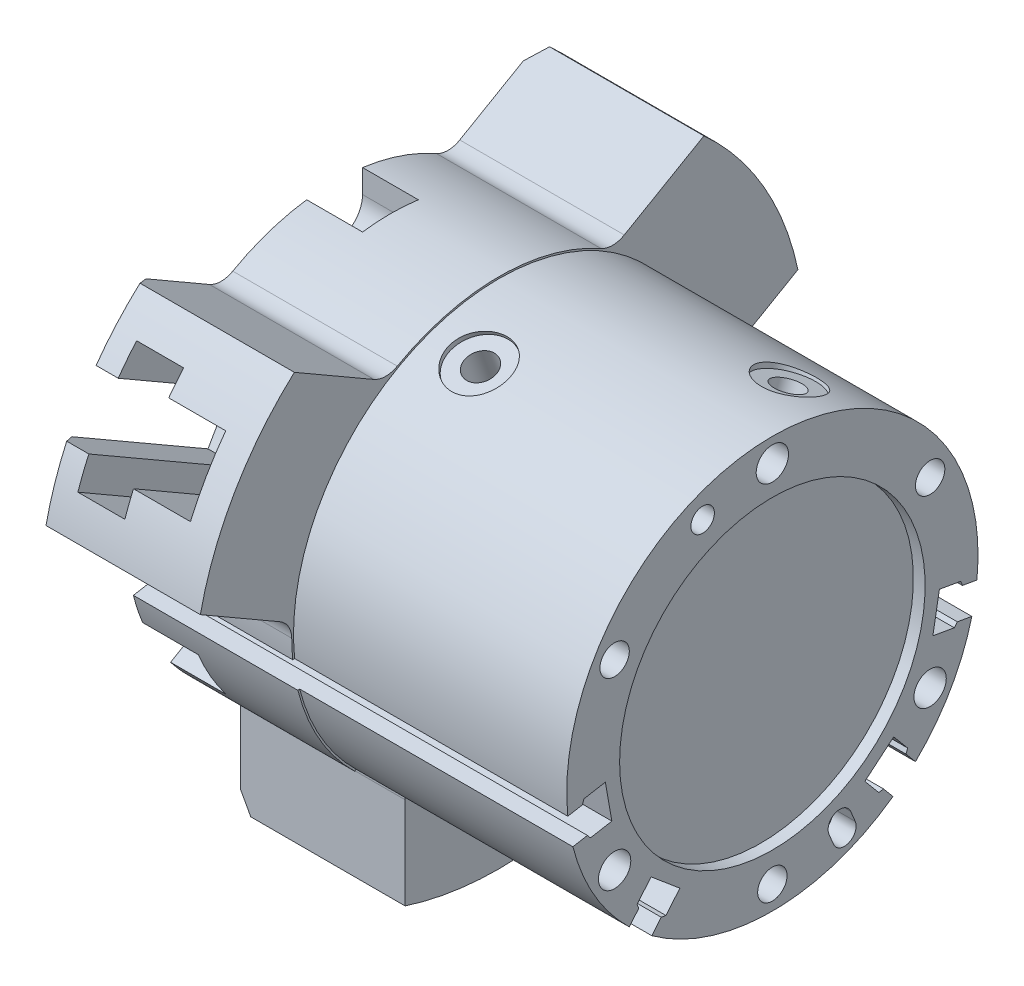
from build123d import *

# Parameters (mm, degrees)
FINGER_CUT1_SKETCH_W   = 13.5
FINGER_CUT1_SKETCH_H   = 30
FINGER_CUT1_DEPTH      = 5
SKETCH1_OUTSIDE_W      = 138.974
SKETCH1_OUTSIDE_H      = 138.974
L_STYLECUT_DEPTH       = 105.681660285
FINGER_CUT2_SKETCH_W   = 8
FINGER_CUT2_SKETCH_H   = 30
FINGER_CUT2_DEPTH      = 10
SKETCH3_W              = 9.7
SKETCH3_H              = 12
L_NOTCH_DEPTH          = 109.662716825
MOUNT_HOLE_SKETCH_R    = 2.75
MOUNT_HOLE_DEPTH       = 105.114490486
MOUNT_GROOVE_START     = -74.5
MOUNT_GROOVE_OUTLINE_R = 2.75
MOUNT_GROOVE_DEPTH     = 9.5
FINGER_MOUNT_SKETCH_R  = 2.5
FINGER_MOUNT_DEPTH     = 10
CIRPATTERN1_COUNT      = 3
REAR_CUT_SKETCH_R      = 2
REAR_CUT_DEPTH         = 4
SWITCH_GROOVE1_DEPTH   = 105.114490486
CIRPATTERN2_COUNT      = 2
CIRPATTERN2_ANGLE      = 40
MIRROR1_COPY_1_DEPTH   = 105.114490486


# Read off the part's stored shape, not the designer's step: Mount_Groove
with BuildPart() as part:
    # Body_Sketch → Body (revolve)
    with BuildSketch(Plane.XY, mode=Mode.PRIVATE) as body_sk:
        Polygon((-2, 0), (-2, 26), (0, 26), (0, 35), (-46.5, 35), (-46.5, 52), (-72.767949192, 52), (-74.5, 49), (-74.5, 0), align=None)
    revolve(body_sk.sketch.rotate(Axis((-65.1, 0, 0), (1, 0, 0)), 90), axis=Axis((-65.1, 0, 0), (1, 0, 0)))

    # Finger_Cut1_Sketch → Finger_Cut1 (cut, symmetric)
    with BuildSketch(Plane.XY):
        with Locations((-67.75, -37)):
            Rectangle(FINGER_CUT1_SKETCH_W, FINGER_CUT1_SKETCH_H)
    finger_cut1 = extrude(amount=FINGER_CUT1_DEPTH, both=True, mode=Mode.SUBTRACT)

    # Sketch1 outside → L-StyleCut (cut, through all)
    with BuildSketch(Plane.ZY.offset(74.5)):
        Rectangle(SKETCH1_OUTSIDE_W, SKETCH1_OUTSIDE_H)
        with BuildLine():
            Line((-16, -49.477267507), (-16, -33.830311852))
            ThreePointArc((-16, -33.830311852), (-16.525630011, -31.848203585), (-17.96437659, -30.387023114))
            ThreePointArc((-17.96437659, -30.387023114), (-30.570696754, -17.65), (-35.298122257, -0.364094933))
            ThreePointArc((-35.298122257, -0.364094933), (-35.844168375, 1.612486389), (-37.297909482, 3.058749465))
            Line((-37.297909482, 3.058749465), (-50.848570571, 10.882227293))
            ThreePointArc((-50.848570571, 10.882227293), (-45.033320997, 26), (-34.848570571, 38.595040214))
            Line((-34.848570571, 38.595040214), (-21.297909482, 30.771562387))
            ThreePointArc((-21.297909482, 30.771562387), (-19.318538364, 30.235717196), (-17.333745667, 30.751118047))
            ThreePointArc((-17.333745667, 30.751118047), (0, 35.3), (17.333745667, 30.751118047))
            ThreePointArc((17.333745667, 30.751118047), (19.318538364, 30.235717196), (21.297909482, 30.771562387))
            Line((21.297909482, 30.771562387), (34.848570571, 38.595040214))
            ThreePointArc((34.848570571, 38.595040214), (45.033320997, 26), (50.848570571, 10.882227293))
            Line((50.848570571, 10.882227293), (37.297909482, 3.058749465))
            ThreePointArc((37.297909482, 3.058749465), (35.844168375, 1.612486389), (35.298122257, -0.364094933))
            ThreePointArc((35.298122257, -0.364094933), (30.570696754, -17.65), (17.96437659, -30.387023114))
            ThreePointArc((17.96437659, -30.387023114), (16.525630011, -31.848203585), (16, -33.830311852))
            Line((16, -33.830311852), (16, -49.477267507))
            ThreePointArc((16, -49.477267507), (0, -52), (-16, -49.477267507))
        make_face(mode=Mode.SUBTRACT)
    extrude(amount=-L_STYLECUT_DEPTH, mode=Mode.SUBTRACT)

    # Finger_Cut2_Sketch → Finger_Cut2 (cut, symmetric)
    with BuildSketch(Plane.XY):
        with Locations((-65, -37)):
            Rectangle(FINGER_CUT2_SKETCH_W, FINGER_CUT2_SKETCH_H)
    finger_cut2 = extrude(amount=FINGER_CUT2_DEPTH, both=True, mode=Mode.SUBTRACT)

    # Sketch3 → L-Notch (cut, through all)
    with BuildSketch(Plane.XZ.offset(22)):
        with Locations((-56.15, 0)):
            Rectangle(SKETCH3_W, SKETCH3_H)
    l_notch = extrude(amount=L_NOTCH_DEPTH, mode=Mode.SUBTRACT)

    # Mount_Hole_Sketch (on Right Plane) → Mount_Hole (cut, through all)
    with BuildSketch(Plane(origin=(0, 0, 0), x_dir=(0, 0, -1), z_dir=(1, 0, 0))):
        with Locations((0, 31)):
            Circle(MOUNT_HOLE_SKETCH_R)
    mount_hole = extrude(amount=-MOUNT_HOLE_DEPTH, mode=Mode.SUBTRACT)

    # Mount_Groove outline → Mount_Groove (cut)
    with BuildSketch(Plane.YZ.offset(MOUNT_GROOVE_START)):
        with BuildLine():
            ThreePointArc((31, 4.75), (26.25, 0), (31, -4.75))
            Line((31, -4.75), (34.97895796, -4.75))
            ThreePointArc((34.97895796, -4.75), (35.3, 0), (34.97895796, 4.75))
            Line((34.97895796, 4.75), (31, 4.75))
        make_face()
        with Locations((31, 0)):
            Circle(MOUNT_GROOVE_OUTLINE_R, mode=Mode.SUBTRACT)
    mount_groove = extrude(amount=MOUNT_GROOVE_DEPTH, mode=Mode.SUBTRACT)

    # Finger_Mount_Sketch → Finger_Mount (cut)
    with BuildSketch(Plane(origin=(0, 0, 0), x_dir=(0, 0, -1), z_dir=(1, 0, 0))):
        with Locations((0, -31)):
            Circle(FINGER_MOUNT_SKETCH_R)
    finger_mount = extrude(amount=-FINGER_MOUNT_DEPTH, mode=Mode.SUBTRACT)

    # CirPattern1: Finger_Cut1, Finger_Cut2, L-Notch, Mount_Hole, Mount_Groove, Finger_Mount ×3 about axis
    cirpattern1_axis = Axis((0, 0, 0), (1, 0, 0))
    add([finger_cut1.rotate(cirpattern1_axis, i * 360 / CIRPATTERN1_COUNT) for i in range(1, CIRPATTERN1_COUNT)], mode=Mode.SUBTRACT)
    add([finger_cut2.rotate(cirpattern1_axis, i * 360 / CIRPATTERN1_COUNT) for i in range(1, CIRPATTERN1_COUNT)], mode=Mode.SUBTRACT)
    add([l_notch.rotate(cirpattern1_axis, i * 360 / CIRPATTERN1_COUNT) for i in range(1, CIRPATTERN1_COUNT)], mode=Mode.SUBTRACT)
    add([mount_hole.rotate(cirpattern1_axis, i * 360 / CIRPATTERN1_COUNT) for i in range(1, CIRPATTERN1_COUNT)], mode=Mode.SUBTRACT)
    add([mount_groove.rotate(cirpattern1_axis, i * 360 / CIRPATTERN1_COUNT) for i in range(1, CIRPATTERN1_COUNT)], mode=Mode.SUBTRACT)
    add([finger_mount.rotate(cirpattern1_axis, i * 360 / CIRPATTERN1_COUNT) for i in range(1, CIRPATTERN1_COUNT)], mode=Mode.SUBTRACT)

    # Opening_Port_Sketch → Opening_Port (revolve, cut)
    with BuildSketch(Plane(origin=(-9, 0, 0), x_dir=(0, 0, -1), z_dir=(1, 0, 0))):
        Polygon((6.201272031, 24.347365878), (8.550503583, 23.49231552), (11.970705016, 32.889241728), (7.272241912, 34.599342444), (6.978452133, 33.79216166), (9.327683685, 32.937111302), align=None)
    revolve(axis=Axis((-9, -32.889241728, 11.970705016), (0, 0.9396926207859105, -0.34202014332566283)), mode=Mode.SUBTRACT)

    # Closing_Port_Sketch → Closing_Port (revolve, cut)
    with BuildSketch(Plane(origin=(-38, 0, 0), x_dir=(0, 0, -1), z_dir=(1, 0, 0)), mode=Mode.PRIVATE) as closing_port_sk:
        Polygon((-10.899735135, 22.637265161), (-8.550503583, 23.49231552), (-11.970705016, 32.889241728), (-16.66916812, 31.179141011), (-16.375378341, 30.371960227), (-14.026146789, 31.227010585), align=None)
    revolve(closing_port_sk.sketch.rotate(Axis((-38, -32.889241728, -11.970705016), (0, 0.9396926207859105, 0.3420201433256631)), 180), axis=Axis((-38, -32.889241728, -11.970705016), (0, 0.9396926207859105, 0.3420201433256631)), mode=Mode.SUBTRACT)

    # Rear_Cut_Sketch → Rear_Cut (cut)
    with BuildSketch(Plane(origin=(0, 0, 0), x_dir=(0, 0, -1), z_dir=(1, 0, 0))):
        with Locations((-11.863186403, 28.640265508)):
            Circle(REAR_CUT_SKETCH_R)
        with BuildLine():
            Line((9.632743906, -28.48175284), (10.398110771, -30.329511905))
            ThreePointArc((10.398110771, -30.329511905), (13.0112367, -31.411904105), (14.093628901, -28.798778176))
            Line((14.093628901, -28.798778176), (13.328262036, -26.951019111))
            ThreePointArc((13.328262036, -26.951019111), (10.715136106, -25.86862691), (9.632743906, -28.48175284))
        make_face()
    extrude(amount=-REAR_CUT_DEPTH, mode=Mode.SUBTRACT)

    # Switch_Groove1_Sketch → Switch_Groove1 (cut, through all)
    with BuildSketch(Plane(origin=(0, 0, 0), x_dir=(0, 0, -1), z_dir=(1, 0, 0))):
        with BuildLine():
            Line((-35.110542542, -3.652369428), (-32.345973855, -3.164901378))
            Line((-32.345973855, -3.164901378), (-32.069522265, -2.405356876))
            Line((-32.069522265, -2.405356876), (-28.425733579, -1.762858618))
            Line((-28.425733579, -1.762858618), (-27.314385242, -8.065628238))
            Line((-27.314385242, -8.065628238), (-30.958173928, -8.708126495))
            Line((-30.958173928, -8.708126495), (-31.477732967, -8.088940143))
            Line((-31.477732967, -8.088940143), (-34.242301653, -8.576408193))
            ThreePointArc((-34.242301653, -8.576408193), (-34.763713681, -6.129780672), (-35.110542542, -3.652369428))
        make_face()
    switch_groove1 = extrude(amount=-SWITCH_GROOVE1_DEPTH, mode=Mode.SUBTRACT)

    # CirPattern2: Switch_Groove1 ×2 about axis
    cirpattern2_axis = Axis((-65.1, 0, 0), (1, 0, 0))
    for i in range(1, CIRPATTERN2_COUNT):
        add(switch_groove1.rotate(cirpattern2_axis, i * CIRPATTERN2_ANGLE / (CIRPATTERN2_COUNT - 1)), mode=Mode.SUBTRACT)

    # Mirror1: Switch_Groove1 across plane
    add(switch_groove1.mirror(Plane.XY), mode=Mode.SUBTRACT)

    # Mirror1 copy 1 sketch → Mirror1 copy 1 (cut, through all)
    with BuildSketch(Plane(origin=(0, 0, 0), x_dir=(0, 0.6427876096865405, 0.766044443118977), z_dir=(1, 0, 0))):
        with BuildLine():
            Line((-35.110542542, 3.652369428), (-32.345973855, 3.164901378))
            Line((-32.345973855, 3.164901378), (-32.069522265, 2.405356876))
            Line((-32.069522265, 2.405356876), (-28.425733579, 1.762858618))
            Line((-28.425733579, 1.762858618), (-27.314385242, 8.065628238))
            Line((-27.314385242, 8.065628238), (-30.958173928, 8.708126495))
            Line((-30.958173928, 8.708126495), (-31.477732967, 8.088940143))
            Line((-31.477732967, 8.088940143), (-34.242301653, 8.576408193))
            ThreePointArc((-34.242301653, 8.576408193), (-34.763713681, 6.129780672), (-35.110542542, 3.652369428))
        make_face()
    extrude(amount=-MIRROR1_COPY_1_DEPTH, mode=Mode.SUBTRACT)


solid = part.part
